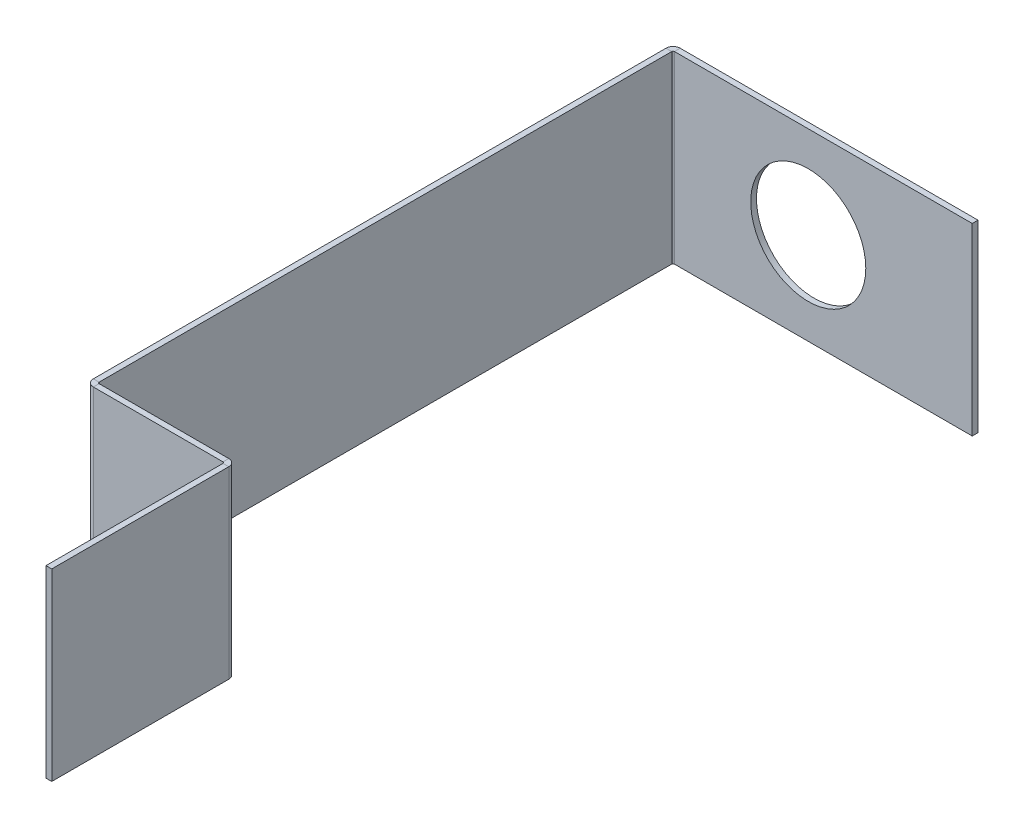
from build123d import *

# Parameters (mm, degrees)
BASE_FLANGE1_DEPTH = 101.6
SKETCH6_R          = 31.75
CUT_EXTRUDE1_DEPTH = 462.763337653


# Sheet-metal steps are written as plain solids
with BuildPart() as part:
    # Sketch1 → Base-Flange1 (new body)
    with BuildSketch(Plane(origin=(0, 0, 0), x_dir=(1, 0, 0), z_dir=(0, 1, 0))):
        with BuildLine():
            Line((76.2, -228.6), (76.2, -130.9116))
            ThreePointArc((76.2, -130.9116), (75.054318885, -128.145681115), (72.2884, -127))
            Line((72.2884, -127), (0.7366, -127))
            ThreePointArc((0.7366, -127), (0.215745145, -126.784254855), (0, -126.2634))
            Line((0, -126.2634), (0, 0))
            Line((0, 0), (0, 189.7634))
            ThreePointArc((0, 189.7634), (0.215745145, 190.284254855), (0.7366, 190.5))
            Line((0.7366, 190.5), (165.1, 190.5))
            Line((165.1, 190.5), (165.1, 193.675))
            Line((165.1, 193.675), (0.7366, 193.675))
            ThreePointArc((0.7366, 193.675), (-2.029318885, 192.529318885), (-3.175, 189.7634))
            Line((-3.175, 189.7634), (-3.175, 0))
            Line((-3.175, 0), (-3.175, -126.2634))
            ThreePointArc((-3.175, -126.2634), (-2.029318885, -129.029318885), (0.7366, -130.175))
            Line((0.7366, -130.175), (72.2884, -130.175))
            ThreePointArc((72.2884, -130.175), (72.809254855, -130.390745145), (73.025, -130.9116))
            Line((73.025, -130.9116), (73.025, -228.6))
            Line((73.025, -228.6), (76.2, -228.6))
        make_face()
    extrude(amount=BASE_FLANGE1_DEPTH)

    # Sketch6 → Cut-Extrude1 (cut, through all)
    with BuildSketch(Plane.XY.offset(-190.5)):
        with Locations((74.5998, 50.8)):
            Circle(SKETCH6_R)
    extrude(amount=-CUT_EXTRUDE1_DEPTH, mode=Mode.SUBTRACT)


solid = part.part
